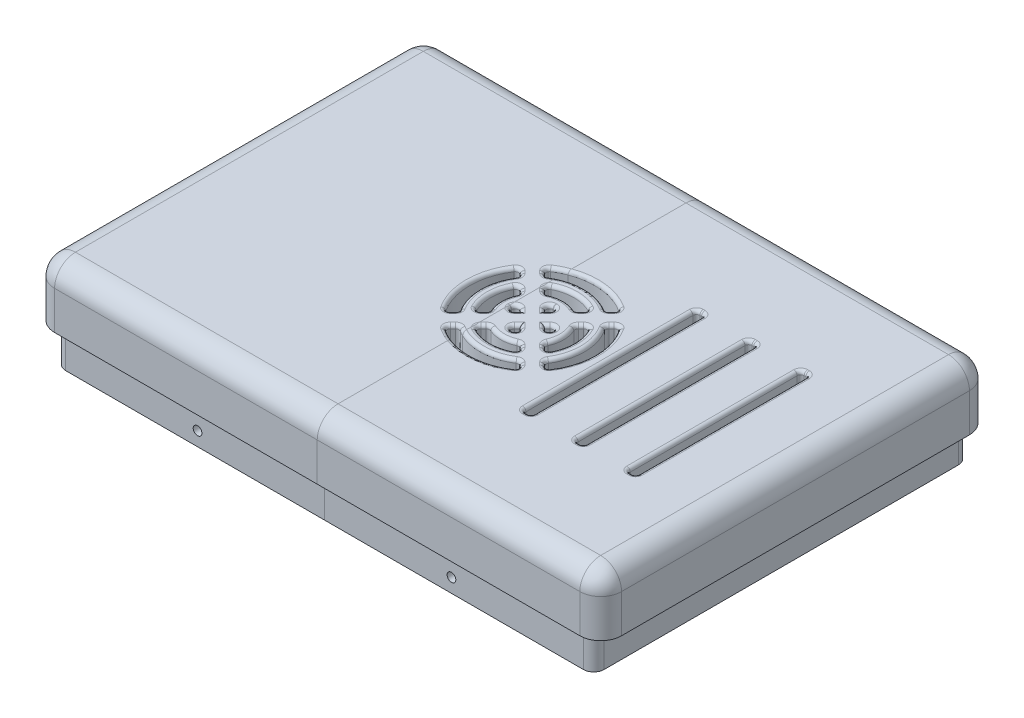
from build123d import *

# Parameters (mm, degrees)
GENERAL_SHAPE_DEPTH            = 7
ESQUISSE2_W                    = 163
ESQUISSE2_H                    = 111.99999999999997
ESQUISSE2_W_2                  = 147
ESQUISSE2_H_2                  = 102.99999999999997
BOSS_EXTRU_2_DEPTH             = 20
ESQUISSE3_W                    = 163
ESQUISSE3_H                    = 111.99999999999997
ESQUISSE3_W_2                  = 154.79999999999995
ESQUISSE3_H_2                  = 107.79999999999995
ENL_V_MAT_EXTRU_1_DEPTH        = 10
FILLET1_R                      = 6
FILLET2_R                      = 6
FILLET3_R                      = 3
FILLET4_R                      = 3
FAN_EXTRUSION_DEPTH            = 7
ESQUISSE5_R                    = 1.2499999999999996
ESQUISSE5_R_2                  = 1.2500000000000013
ESQUISSE5_R_3                  = 1.2499999999999991
FAN_SCREE_HOLES_DEPTH          = 5
FAN_FILLET_R                   = 1
ESQUISSE8_W                    = 2.500000000000007
ESQUISSE8_H                    = 50.00000000000001
ESQUISSE8_H_2                  = 50
ESQUISSE8_W_2                  = 2.5
PASSIVE_AIR_EXTRUSION_DEPTH    = 7
PASSIVE_AIR_EXTRUSION_FILLET_R = 1
ESQUISSE9_R                    = 1.2500000000000047
CLOSING_SCREW_HOLES_DEPTH      = 139.27602838518325


with BuildPart() as part:
    # Esquisse1 → General shape (new body)
    with BuildSketch(Plane(origin=(0, 0, 0), x_dir=(1, 0, 0), z_dir=(0, 1, 0))):
        Polygon((-81.5, 56.00000000000002), (81.49999999999999, 56.00000000000002), (81.5, -55.99999999999998), (-81.5, -55.99999999999998), align=None)
    extrude(amount=GENERAL_SHAPE_DEPTH)

    # Esquisse2 → Boss.-Extru.2 (add)
    with BuildSketch(Plane.XZ):
        Rectangle(ESQUISSE2_W, ESQUISSE2_H)
        Rectangle(ESQUISSE2_W_2, ESQUISSE2_H_2, mode=Mode.SUBTRACT)
    extrude(amount=BOSS_EXTRU_2_DEPTH)

    # Esquisse3 → Enlèv. mat.-Extru.1 (cut)
    with BuildSketch(Plane(origin=(0, -20, 0), x_dir=(-1, 0, 0), z_dir=(0, -1, 0))):
        Rectangle(ESQUISSE3_W, ESQUISSE3_H)
        Rectangle(ESQUISSE3_W_2, ESQUISSE3_H_2, mode=Mode.SUBTRACT)
    extrude(amount=-ENL_V_MAT_EXTRU_1_DEPTH, mode=Mode.SUBTRACT)

    # Fillet1
    fillet1_edges = [part.edges().sort_by_distance(p)[0] for p in [
        (81.5, -1.5, 55.99999999999998),
        (-81.5, -1.5, 55.99999999999998),
        (-81.5, -1.5, -56.000000000000014),
        (81.5, -1.5, -56.000000000000014),
    ]]
    fillet(fillet1_edges, radius=FILLET1_R)

    # Fillet2
    fillet2_edges = [part.edges().sort_by_distance(p)[0] for p in [
        (81.5, 7, -2.132e-14),
        (0, 7, 55.99999999999998),
        (0, 7, -56.00000000000002),
        (-81.5, 7, -2.842e-14),
        (-79.74264068711929, 7, 54.24264068711926),
        (-79.74264068711929, 6.999999999999996, -54.24264068711933),
        (79.74264068711929, 7, -54.242640687119305),
        (79.74264068711929, 7.000000000000003, 54.24264068711926),
    ]]
    fillet(fillet2_edges, radius=FILLET2_R)

    # Fillet3
    fillet3_edges = [part.edges().sort_by_distance(p)[0] for p in [
        (-73.50000000000001, 0, 0),
        (-1.421e-14, 0, -51.499999999999986),
        (73.49999999999999, 0, 0),
        (-1.421e-14, 0, 51.499999999999986),
    ]]
    fillet(fillet3_edges, radius=FILLET3_R)

    # Fillet4
    fillet4_edges = [part.edges().sort_by_distance(p)[0] for p in [
        (-77.39999999999999, -15, 53.899999999999984),
        (77.39999999999998, -15, 53.899999999999984),
        (77.39999999999998, -15, -53.89999999999997),
        (-77.39999999999999, -15, -53.89999999999997),
    ]]
    fillet(fillet4_edges, radius=FILLET4_R)

    # Esquisse4 → Fan_extrusion (cut)
    with BuildSketch(Plane.XZ):
        with BuildLine():
            ThreePointArc((0.8754208918982833, 2.759045202169105), (0.4999999999999938, 0.6699999999999978), (0.8754208918982833, -1.4190452021691093))
            Line((0.875420891898191, -1.4190452021690696), (2.9644660940672516, 0.669999999999991))
            Line((2.9644660940672587, 0.6699999999999946), (0.8754208918981945, 2.759045202169059))
        make_face()
        with BuildLine():
            ThreePointArc((-3.5668632893152568, 7.201329383382595), (-5.500000000000004, 0.6699999999999985), (-3.5668632893152568, -5.861329383382598))
            Line((-3.566863289315309, -5.86132938338257), (-1.381276583285155, -3.6757426773524156))
            ThreePointArc((-1.3812765832850706, -3.67574267735246), (-2.500000000000006, 0.6699999999999982), (-1.3812765832850697, 5.015742677352456))
            Line((-1.3812765832851532, 5.0157426773524065), (-3.566863289315311, 7.201329383382561))
        make_face()
        with BuildLine():
            ThreePointArc((-7.8723296189222856, 11.506795712988652), (-11.500000000000004, 0.6699999999999993), (-7.872329618922284, -10.166795712988662))
            Line((-7.8723296189217855, -10.166795712989046), (-5.7260172846422, -8.02048337870946))
            ThreePointArc((-5.726017284642626, -8.020483378709148), (-8.500000000000007, 0.669999999999979), (-5.726017284642647, 9.36048337870911))
            Line((-5.726017284642186, 9.360483378709436), (-7.872329618921782, 11.506795712989032))
        make_face()
        with BuildLine():
            ThreePointArc((-4.336795712989226, -13.702329618921857), (6.500000000000052, -17.33), (17.33679571298932, -13.702329618921775))
            Line((17.3367957129892, -13.702329618921938), (15.190483378709516, -11.556017284642257))
            ThreePointArc((15.190483378709374, -11.556017284642452), (6.4999999999998295, -14.330000000000002), (-2.190483378709666, -11.556017284642255))
            Line((-2.1904833787096045, -11.55601728464234), (-4.336795712989181, -13.702329618921919))
        make_face()
        with BuildLine():
            ThreePointArc((-0.03132938338297375, -9.396863289315013), (6.499999999999777, -11.33), (13.031329383382587, -9.396863289315252))
            Line((13.031329383382559, -9.3968632893153), (10.845742677352403, -7.211276583285146))
            ThreePointArc((10.845742677352447, -7.211276583285065), (6.500000000000038, -8.330000000000002), (2.1542573226476165, -7.211276583285111))
            Line((2.15425732264762, -7.211276583285114), (-0.03132938338269398, -9.396863289315428))
        make_face()
        with BuildLine():
            ThreePointArc((4.410954797831026, -4.954579108101764), (6.500000000000071, -5.330000000000001), (8.589045202169102, -4.954579108101711))
            Line((8.589045202169054, -4.9545791081018), (6.5, -2.865533905932743))
            Line((6.499999999999995, -2.865533905932743), (4.410954797831009, -4.954579108101729))
        make_face()
        with BuildLine():
            Line((18.726017284642253, -8.02048337870952), (20.87232961892193, -10.166795712989199))
            ThreePointArc((20.872329618921757, -10.166795712989337), (23.5690060217429, -5.043933271373075), (24.49999999999999, 0.6699999999999926))
            ThreePointArc((24.49999999999999, 0.669999999999997), (23.569006021742904, 6.383933271373055), (20.872329618921764, 11.506795712989323))
            Line((20.872329618921924, 11.506795712989188), (18.726017284642246, 9.360483378709517))
            ThreePointArc((18.726017284642445, 9.360483378709368), (20.789686127932207, 5.231235618248803), (21.49999999999999, 0.669999999999997))
            ThreePointArc((21.49999999999999, 0.6699999999999934), (20.789686127932207, -3.891235618248813), (18.726017284642445, -8.02048337870938))
        make_face()
        with BuildLine():
            Line((14.381276583285134, -3.6757426773524013), (16.566863289315293, -5.861329383382563))
            ThreePointArc((16.56686328931524, -5.861329383382602), (18.006571154600802, -2.73570407758932), (18.49999999999999, 0.6699999999999942))
            ThreePointArc((18.49999999999999, 0.669999999999997), (18.006571154600802, 4.075704077589312), (16.56686328931524, 7.201329383382595))
            Line((16.566863289315293, 7.201329383382561), (14.381276583285137, 5.015742677352403))
            ThreePointArc((14.381276583285057, 5.015742677352449), (15.21583298513588, 2.9137146376527436), (15.49999999999999, 0.669999999999997))
            ThreePointArc((15.49999999999999, 0.6699999999999948), (15.21583298513588, -1.5737146376527555), (14.381276583285057, -3.6757426773524555))
        make_face()
        with BuildLine():
            Line((10.03553390593273, 0.6700000000000017), (12.124579108101791, -1.419045202169059))
            ThreePointArc((12.1245791081017, -1.4190452021691093), (12.4053989978921, -0.3912552358857293), (12.49999999999999, 0.6699999999999956))
            ThreePointArc((12.49999999999999, 0.669999999999997), (12.4053989978921, 1.7312552358857214), (12.124579108101702, 2.7590452021691005))
            Line((12.124579108101793, 2.759045202169059), (10.035533905932736, 0.6700000000000017))
        make_face()
        with BuildLine():
            ThreePointArc((8.589045202169098, 6.294579108101706), (6.500000000000059, 6.6699999999999955), (4.410954797831012, 6.294579108101754))
            Line((4.410954797830996, 6.294579108101736), (6.499999999999993, 4.2055339059327395))
            Line((6.4999999999999964, 4.205533905932736), (8.589045202169054, 6.294579108101793))
        make_face()
        with BuildLine():
            ThreePointArc((13.031329383382591, 10.736863289315243), (6.49999999999978, 12.669999999999993), (-0.03132938338296576, 10.73686328931501))
            Line((-0.03132938338269042, 10.736863289315423), (2.154257322647613, 8.55127658328512))
            ThreePointArc((2.1542573226476183, 8.551276583285105), (6.500000000000036, 9.669999999999995), (10.845742677352444, 8.551276583285063))
            Line((10.845742677352387, 8.551276583285127), (13.031329383382545, 10.736863289315284))
        make_face()
        with BuildLine():
            ThreePointArc((17.33679571298932, 15.042329618921766), (6.500000000000057, 18.669999999999995), (-4.336795712989228, 15.042329618921848))
            Line((-4.336795712989183, 15.042329618921915), (-2.190483378709608, 12.89601728464234))
            ThreePointArc((-2.190483378709664, 12.896017284642252), (6.499999999999816, 15.669999999999995), (15.19048337870936, 12.896017284642454))
            Line((15.190483378709501, 12.896017284642241), (17.336795712989186, 15.042329618921926))
        make_face()
    extrude(amount=-FAN_EXTRUSION_DEPTH, mode=Mode.SUBTRACT)

    # Esquisse5 → Fan_scree_holes (cut)
    with BuildSketch(Plane.XZ):
        with Locations(Location((-9.550000000000006, 16.72, 0), (0, 0, 270))):
            Circle(ESQUISSE5_R)
        with Locations(Location((22.549999999999997, 16.720000000000002, 0), (0, 0, 270))):
            Circle(ESQUISSE5_R_2)
        with Locations(Location((22.549999999999997, -15.38, 0), (0, 0, 270))):
            Circle(ESQUISSE5_R_2)
        with Locations(Location((-9.550000000000006, -15.380000000000004, 0), (0, 0, 270))):
            Circle(ESQUISSE5_R_3)
    extrude(amount=-FAN_SCREE_HOLES_DEPTH, mode=Mode.SUBTRACT)

    # Fan_fillet
    fan_fillet_edges = [part.edges().sort_by_distance(p)[0] for p in [
        (1.9199434929827266, 0, 1.7145226010845267),
        (0.49999999999999467, 0, 0.6699999999999976),
        (1.9199434929827213, 0, -0.3745226010845393),
        (0.49999999999999467, 7, 0.6699999999999976),
        (0.8754208918982371, 3.5, -1.4190452021690898),
        (1.9199434929827213, 7, -0.3745226010845393),
        (1.9199434929827266, 7, 1.7145226010845267),
        (0.8754208918982389, 3.5, 2.759045202169082),
        (-2.500000000000007, 7, 0.6699999999999979),
        (-2.474069936300232, 0, 6.108536030367484),
        (-5.500000000000005, 0, 0.6699999999999993),
        (-2.474069936300232, 0, -4.768536030367493),
        (-2.474069936300232, 7, 6.108536030367484),
        (-3.5668632893152843, 3.5, 7.201329383382578),
        (-5.500000000000005, 7, 0.6699999999999993),
        (-3.5668632893152843, 3.5, -5.861329383382584),
        (-2.474069936300232, 7, -4.768536030367493),
        (-1.3812765832851128, 3.5, -3.6757426773524378),
        (-1.381276583285112, 3.5, 5.015742677352431),
        (-2.500000000000007, 0, 0.6699999999999979),
        (-8.500000000000007, 7, 0.6699999999999777),
        (-6.799173451781984, 0, 10.433639545849234),
        (-11.500000000000004, 0, 0.6699999999999946),
        (-6.799173451781993, 0, -9.093639545849253),
        (-6.799173451781984, 7, 10.433639545849234),
        (-7.872329618922034, 3.5, 11.506795712988842),
        (-11.500000000000004, 7, 0.6699999999999946),
        (-7.872329618922034, 3.5, -10.166795712988854),
        (-6.799173451781993, 7, -9.093639545849253),
        (-5.726017284642413, 3.5, -8.020483378709304),
        (-5.726017284642417, 3.5, 9.360483378709272),
        (-8.500000000000007, 0, 0.6699999999999777),
        (-2.1904833787096347, 3.5, -11.556017284642298),
        (6.499999999999824, 0, -14.330000000000005),
        (16.263639545849358, 7, -12.629173451782098),
        (15.190483378709445, 3.5, -11.556017284642355),
        (6.500000000000061, 7, -17.33),
        (17.33679571298926, 3.5, -13.702329618921857),
        (-4.336795712989204, 3.5, -13.702329618921887),
        (-3.2636395458493928, 0, -12.62917345178213),
        (6.500000000000061, 0, -17.33),
        (16.263639545849358, 0, -12.629173451782098),
        (-3.2636395458493928, 7, -12.62917345178213),
        (6.499999999999824, 7, -14.330000000000005),
        (2.1542573226476174, 3.5, -7.2112765832851125),
        (6.500000000000036, 0, -8.330000000000002),
        (11.93853603036748, 7, -8.304069936300223),
        (10.845742677352426, 3.5, -7.211276583285106),
        (6.499999999999772, 7, -11.330000000000002),
        (13.031329383382573, 3.5, -9.396863289315277),
        (-0.03132938338283431, 3.5, -9.39686328931522),
        (1.061463969632463, 0, -8.304069936300271),
        (6.499999999999772, 0, -11.330000000000002),
        (11.93853603036748, 0, -8.304069936300223),
        (1.061463969632463, 7, -8.304069936300271),
        (6.500000000000036, 7, -8.330000000000002),
        (5.455477398915502, 7, -3.910056507017236),
        (6.500000000000069, 0, -5.330000000000002),
        (7.544522601084527, 0, -3.9100565070172717),
        (6.500000000000069, 7, -5.330000000000002),
        (8.589045202169078, 3.5, -4.954579108101757),
        (7.544522601084527, 7, -3.9100565070172717),
        (4.4109547978310175, 3.5, -4.954579108101747),
        (5.455477398915502, 0, -3.910056507017236),
        (18.72601728464235, 3.5, -8.02048337870945),
        (21.49999999999999, 0, 0.6699999999999947),
        (18.726017284642346, 3.5, 9.360483378709443),
        (19.799173451782085, 0, 10.433639545849353),
        (24.49999999999999, 7, 0.6699999999999955),
        (20.872329618921846, 3.5, 11.506795712989256),
        (20.872329618921846, 3.5, -10.166795712989268),
        (19.799173451782092, 0, -9.09363954584936),
        (24.499999999999986, 0, 0.6699999999999908),
        (19.799173451782092, 7, -9.09363954584936),
        (21.499999999999986, 7, 0.6699999999999986),
        (19.799173451782085, 7, 10.433639545849353),
        (14.381276583285096, 3.5, -3.675742677352428),
        (15.499999999999993, 0, 0.669999999999998),
        (14.381276583285096, 3.5, 5.015742677352426),
        (15.474069936300214, 0, 6.108536030367482),
        (18.499999999999986, 7, 0.669999999999998),
        (16.566863289315265, 3.5, 7.201329383382578),
        (16.566863289315265, 3.5, -5.861329383382581),
        (15.474069936300214, 0, -4.768536030367482),
        (18.49999999999999, 0, 0.6699999999999976),
        (15.474069936300214, 7, -4.768536030367482),
        (15.49999999999999, 7, 0.6699999999999994),
        (15.474069936300214, 7, 6.108536030367482),
        (11.080056507017261, 7, -0.3745226010845286),
        (11.080056507017265, 7, 1.7145226010845303),
        (12.499999999999991, 0, 0.6699999999999976),
        (12.499999999999991, 7, 0.6699999999999975),
        (12.124579108101749, 3.5, 2.75904520216908),
        (11.080056507017265, 0, 1.7145226010845303),
        (12.124579108101747, 3.5, -1.4190452021690843),
        (11.080056507017261, 0, -0.3745226010845286),
        (5.4554773989154945, 7, 5.250056507017238),
        (7.544522601084525, 0, 5.2500565070172645),
        (6.5000000000000595, 0, 6.669999999999994),
        (6.5000000000000595, 7, 6.669999999999994),
        (4.410954797831004, 3.5, 6.294579108101745),
        (5.4554773989154945, 0, 5.250056507017238),
        (7.544522601084525, 7, 5.2500565070172645),
        (8.589045202169075, 3.5, 6.294579108101749),
        (6.500000000000037, 7, 9.669999999999995),
        (1.0614639696324613, 7, 9.644069936300271),
        (11.938536030367466, 0, 9.644069936300205),
        (6.499999999999778, 0, 12.669999999999995),
        (11.938536030367466, 7, 9.644069936300205),
        (13.031329383382568, 3.5, 10.736863289315263),
        (6.499999999999778, 7, 12.669999999999995),
        (-0.03132938338282898, 3.5, 10.736863289315217),
        (2.1542573226476156, 3.5, 8.551276583285112),
        (1.0614639696324613, 0, 9.644069936300271),
        (10.845742677352415, 3.5, 8.551276583285095),
        (6.500000000000037, 0, 9.669999999999995),
        (6.499999999999815, 7, 15.669999999999995),
        (-3.2636395458493954, 7, 13.969173451782128),
        (16.263639545849344, 0, 13.969173451782083),
        (6.5000000000000595, 0, 18.669999999999995),
        (16.263639545849344, 7, 13.969173451782083),
        (17.336795712989254, 3.5, 15.042329618921848),
        (6.5000000000000595, 7, 18.669999999999995),
        (-4.336795712989204, 3.5, 15.042329618921883),
        (-2.190483378709636, 3.5, 12.896017284642296),
        (-3.2636395458493954, 0, 13.969173451782128),
        (15.19048337870943, 3.5, 12.896017284642348),
        (6.499999999999815, 0, 15.669999999999995),
    ]]
    fillet(fan_fillet_edges, radius=FAN_FILLET_R)

    # Esquisse8 → Passive_air_extrusion (cut)
    with BuildSketch(Plane(origin=(0, 7, 0), x_dir=(1, 0, 0), z_dir=(0, 1, 0))):
        with Locations((44.250000000000014, 0)):
            Rectangle(ESQUISSE8_W, ESQUISSE8_H)
        with Locations((59.250000000000014, 1.0125e-13)):
            Rectangle(ESQUISSE8_W, ESQUISSE8_H_2)
        with Locations((29.25000000000001, -1.0125e-13)):
            Rectangle(ESQUISSE8_W_2, ESQUISSE8_H_2)
    extrude(amount=-PASSIVE_AIR_EXTRUSION_DEPTH, mode=Mode.SUBTRACT)

    # Passive_air_extrusion_fillet
    passive_air_extrusion_fillet_edges = [part.edges().sort_by_distance(p)[0] for p in [
        (60.500000000000014, 3.5, -25.000000000000107),
        (60.500000000000014, 3.5, 24.999999999999897),
        (58.00000000000001, 3.5, 24.999999999999897),
        (58.00000000000001, 3.5, -25.000000000000107),
        (60.500000000000014, 7, -1.0303e-13),
        (59.250000000000014, 7, -25.000000000000107),
        (58.00000000000001, 7, -1.0658e-13),
        (59.250000000000014, 7, 24.999999999999897),
        (60.500000000000014, 0, -1.0303e-13),
        (59.250000000000014, 0, 24.999999999999897),
        (58.00000000000001, 0, -1.0658e-13),
        (59.250000000000014, 0, -25.000000000000107),
        (43.00000000000001, 3.5, -25),
        (45.500000000000014, 3.5, -25),
        (45.500000000000014, 3.5, 25),
        (43.00000000000001, 3.5, 25),
        (44.250000000000014, 7, -25),
        (43.00000000000001, 7, 0),
        (44.250000000000014, 7, 25),
        (45.500000000000014, 7, 0),
        (44.250000000000014, 0, -25),
        (45.500000000000014, 0, 0),
        (44.250000000000014, 0, 25),
        (43.00000000000001, 0, 0),
        (28.00000000000001, 3.5, -24.999999999999897),
        (30.500000000000014, 3.5, -24.999999999999897),
        (30.500000000000014, 3.5, 25.000000000000107),
        (28.00000000000001, 3.5, 25.000000000000107),
        (29.250000000000014, 7, -24.999999999999897),
        (28.00000000000001, 7, 1.0303e-13),
        (29.250000000000014, 7, 25.000000000000107),
        (30.500000000000014, 7, 1.0658e-13),
        (29.250000000000014, 0, -24.999999999999897),
        (30.500000000000014, 0, 1.0658e-13),
        (29.250000000000014, 0, 25.000000000000107),
        (28.00000000000001, 0, 1.0303e-13),
    ]]
    fillet(passive_air_extrusion_fillet_edges, radius=PASSIVE_AIR_EXTRUSION_FILLET_R)


with BuildPart() as body_2:
    # Middle_split: the piece on the far side of the plane
    add(part.part)
    split(bisect_by=Plane(origin=(0, 0, 0), x_dir=(0, 0, 1), z_dir=(1, 0, 0)), keep=Keep.BOTTOM)


with BuildPart() as part_1:
    add(part.part)

    # Middle_split
    split(bisect_by=Plane(origin=(0, 0, 0), x_dir=(0, 0, 1), z_dir=(1, 0, 0)), keep=Keep.TOP)


with BuildPart() as closing_screw_holes_tool:
    # Esquisse9 → Closing_screw_holes (new, through all)
    with BuildSketch(Plane.XY.offset(53.899999999999984)):
        with Locations((-36.5, -16)):
            Circle(ESQUISSE9_R)
        with Locations((36.499999999999986, -15.999999999999966)):
            Circle(ESQUISSE9_R)
    extrude(amount=-CLOSING_SCREW_HOLES_DEPTH)


with BuildPart() as part_2:
    add(part_1.part)

    # Closing_screw_holes: cut by closing_screw_holes_tool
    add(closing_screw_holes_tool.part, mode=Mode.SUBTRACT)


with BuildPart() as body_2_1:
    add(body_2.part)

    # Closing_screw_holes: cut by closing_screw_holes_tool
    add(closing_screw_holes_tool.part, mode=Mode.SUBTRACT)


solid = Compound([part_2.part, body_2_1.part])
